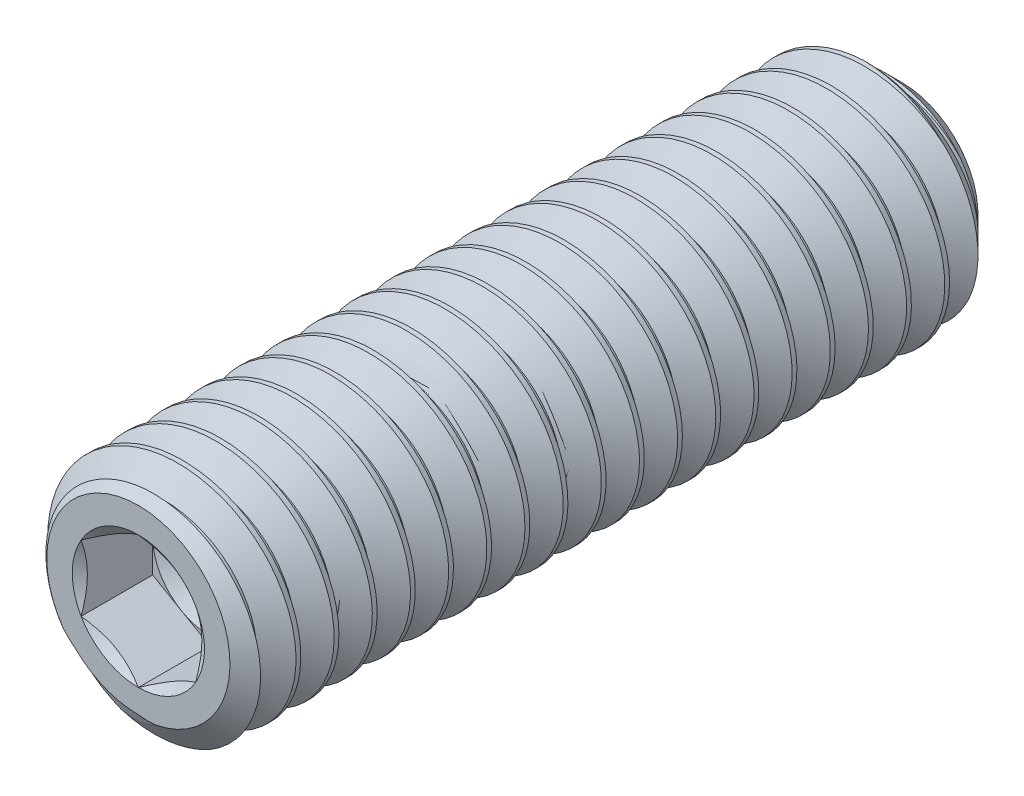
from build123d import *

# Parameters (mm, degrees)
CUT_SWEEP2_PITCH    = 0.5
CUT_EXTRUDE10_DEPTH = 0.9375


with BuildPart() as part:
    # Sketch22 → Revolve1 (revolve)
    with BuildSketch(Plane(origin=(0, 0, 0), x_dir=(0, 0, -1), z_dir=(1, 0, 0)), mode=Mode.PRIVATE) as revolve1_sk:
        Polygon((-5, 0), (-5, 1.2), (-4.789937739, 1.5), (4.5, 1.5), (5, 1), (5, 0), align=None)
    revolve(revolve1_sk.sketch.rotate(Axis((0, 0, -5), (0, 0, 1)), 90), axis=Axis((0, 0, -5), (0, 0, 1)))

    # Cut-Sweep2: the profile of Sketch28 profile screwed along a right-hand helix of 21 turns, 6 arcs to a turn; built about Z, then put on its axis
    cut_sweep2_z = Axis((0, 0, 0), (0, 0, 1))
    cut_sweep2_corners = [(1.5003, 0, 0.000173205), (1.5003, 0, -0.437673205), (1.175240474, 0, -0.25), (1.175240474, 0, -0.1875)]
    with BuildLine(mode=Mode.PRIVATE) as cut_sweep2_profile:
        Line(cut_sweep2_corners[0], cut_sweep2_corners[1])
        Line(cut_sweep2_corners[1], cut_sweep2_corners[2])
        Line(cut_sweep2_corners[2], cut_sweep2_corners[3])
        Line(cut_sweep2_corners[3], cut_sweep2_corners[0])
    cut_sweep2_cap = Face(cut_sweep2_profile.wire())
    cut_sweep2_turn_angles = [0, 30, 60, 90, 120, 150, 180, 210, 240, 270, 300, 330, 360]
    cut_sweep2_turn_weights = [1, 0.8660254037844387, 1, 0.8660254037844387, 1, 0.8660254037844387, 1, 0.8660254037844387, 1, 0.8660254037844387, 1, 0.8660254037844387, 1]
    cut_sweep2_turn_rails = [Edge.make_bspline([Vector(p[0], p[1], 0).rotate(cut_sweep2_z, cut_sweep2_turn_angles[k]) / cut_sweep2_turn_weights[k] + Vector(0, 0, p[2] + CUT_SWEEP2_PITCH * cut_sweep2_turn_angles[k] / 360) for k in range(13)], [0, 0, 0, 1, 1, 2, 2, 3, 3, 4, 4, 5, 5, 6, 6, 6], 2, cut_sweep2_turn_weights) for p in cut_sweep2_corners]
    cut_sweep2_turn_sides = [Face.make_surface_from_curves(cut_sweep2_turn_rails[p[0]], cut_sweep2_turn_rails[p[1]]) for p in [(0, 1), (1, 2), (2, 3), (3, 0)]]
    cut_sweep2 = Plane(origin=(0, 0, -5), x_dir=(0, 1, 0), z_dir=(0, 0, 1)) * Solid(Shell([*[p.moved(Location((0, 0, CUT_SWEEP2_PITCH * i))) for i in range(21) for p in cut_sweep2_turn_sides], cut_sweep2_cap, cut_sweep2_cap.rotate(cut_sweep2_z, 7560).moved(Location((0, 0, CUT_SWEEP2_PITCH * 7560 / 360)))]))
    add(cut_sweep2, mode=Mode.SUBTRACT)

    # Sketch23 → Cut-Extrude10 (cut)
    with BuildSketch(Plane.XY.offset(5)):
        Polygon((0, 0.866025404), (-0.75, 0.433012702), (-0.75, -0.433012702), (0, -0.866025404), (0.75, -0.433012702), (0.75, 0.433012702), align=None)
    extrude(amount=-CUT_EXTRUDE10_DEPTH, mode=Mode.SUBTRACT)

    # Cut-Extrude11 cone 1 section (through the dimple's axis) → Cut-Extrude11 (revolve, cut)
    with BuildSketch(Plane(origin=(0, 0, 5), x_dir=(0, -1, 0), z_dir=(1, 0, 0))):
        Polygon((0, 0), (0.866025404, 0), (0, 0.606397516), align=None)
    revolve(axis=Axis((0, 0, 5), (0, 0, -1)), mode=Mode.SUBTRACT)

    # Cut-Extrude12 cone 1 section (through the dimple's axis) → Cut-Extrude12 (revolve, cut)
    with BuildSketch(Plane(origin=(0, 0, 4.0625), x_dir=(0, -1, 0), z_dir=(1, 0, 0))):
        Polygon((0, 0), (0.75, 0), (0, 0.433012702), align=None)
    revolve(axis=Axis((0, 0, 4.0625), (0, 0, -1)), mode=Mode.SUBTRACT)


solid = part.part
